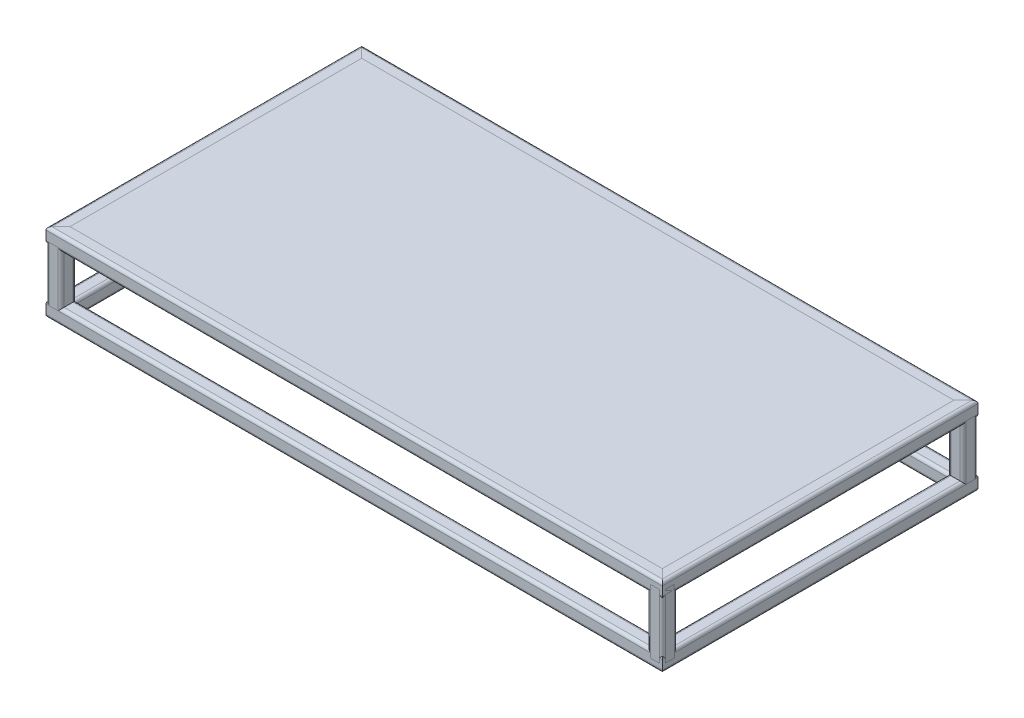
from build123d import *

# Parameters (mm, degrees)
SQUARE_TUBE_20_X_20_X_2_1_DEPTH      = 815.142135624
SQUARE_TUBE_20_X_20_X_2_1_DEPTH_BACK = 15.142135624
SQUARE_TUBE_20_X_20_X_2_1_2_DEPTH    = 430.284271247
SQUARE_TUBE_20_X_20_X_2_1_3_DEPTH    = 830.284271247
SQUARE_TUBE_20_X_20_X_2_1_4_DEPTH    = 430.284271247
SQUARE_TUBE_20_X_20_X_2_2_DEPTH      = 85
SQUARE_TUBE_20_X_20_X_2_2_2_DEPTH    = 85
SQUARE_TUBE_20_X_20_X_2_2_3_DEPTH    = 85
SQUARE_TUBE_20_X_20_X_2_2_4_DEPTH    = 85
SKETCH12_W                           = 788
SKETCH12_H                           = 388
BASE_FLANGE1_DEPTH                   = 2
SQUARE_TUBE_20_X_20_X_2_3_DEPTH      = 415.142135624
SQUARE_TUBE_20_X_20_X_2_3_DEPTH_BACK = 15.142135624
SQUARE_TUBE_20_X_20_X_2_3_2_DEPTH    = 830.284271247
SQUARE_TUBE_20_X_20_X_2_3_3_DEPTH    = 430.284271247
SQUARE_TUBE_20_X_20_X_2_3_4_DEPTH    = 830.284271247


# Sheet-metal steps are written as plain solids
with BuildPart() as part:
    # Sketch11 → Square tube 20 X 20 X 2(1) (new, two sides: drawn at the far end of the back side and taken through both)
    with BuildSketch(Plane(origin=(0, 85, 0), x_dir=(0, 0, -1), z_dir=(1, 0, 0)).offset(-SQUARE_TUBE_20_X_20_X_2_1_DEPTH_BACK)):
        with BuildLine():
            Line((-6, -10), (6, -10))
            ThreePointArc((6, -10), (8.828427125, -8.828427125), (10, -6))
            Line((10, -6), (10, 6))
            ThreePointArc((10, 6), (8.828427125, 8.828427125), (6, 10))
            Line((6, 10), (-6, 10))
            ThreePointArc((-6, 10), (-8.828427125, 8.828427125), (-10, 6))
            Line((-10, 6), (-10, -6))
            ThreePointArc((-10, -6), (-8.828427125, -8.828427125), (-6, -10))
        make_face()
        with BuildLine():
            Line((-6, -8), (6, -8))
            ThreePointArc((6, -8), (7.414213562, -7.414213562), (8, -6))
            Line((8, -6), (8, 6))
            ThreePointArc((8, 6), (7.414213562, 7.414213562), (6, 8))
            Line((6, 8), (-6, 8))
            ThreePointArc((-6, 8), (-7.414213562, 7.414213562), (-8, 6))
            Line((-8, 6), (-8, -6))
            ThreePointArc((-8, -6), (-7.414213562, -7.414213562), (-6, -8))
        make_face(mode=Mode.SUBTRACT)
    extrude(amount=SQUARE_TUBE_20_X_20_X_2_1_DEPTH + SQUARE_TUBE_20_X_20_X_2_1_DEPTH_BACK)

    # Square tube 20 X 20 X 2(1) mitre 1
    split(bisect_by=Plane(origin=(0, 85, 0), x_dir=(0, 1, 0), z_dir=(0.707106781, 0, 0.707106781)), keep=Keep.TOP)

    # Square tube 20 X 20 X 2(1) mitre 2
    split(bisect_by=Plane(origin=(800, 85, 0), x_dir=(0, -1, 0), z_dir=(-0.707106781, 0, 0.707106781)), keep=Keep.TOP)


with BuildPart() as body_2:
    # Sketch11 on segment 2 (carried to segment 2) → Square tube 20 X 20 X 2_1 2 (new body)
    with BuildSketch(Plane(origin=(800, 85, 15.142135624), x_dir=(-1, 0, 0), z_dir=(0, 0, -1))):
        with BuildLine():
            Line((-6, -10), (6, -10))
            ThreePointArc((6, -10), (8.828427125, -8.828427125), (10, -6))
            Line((10, -6), (10, 6))
            ThreePointArc((10, 6), (8.828427125, 8.828427125), (6, 10))
            Line((6, 10), (-6, 10))
            ThreePointArc((-6, 10), (-8.828427125, 8.828427125), (-10, 6))
            Line((-10, 6), (-10, -6))
            ThreePointArc((-10, -6), (-8.828427125, -8.828427125), (-6, -10))
        make_face()
        with BuildLine():
            Line((-6, -8), (6, -8))
            ThreePointArc((6, -8), (7.414213562, -7.414213562), (8, -6))
            Line((8, -6), (8, 6))
            ThreePointArc((8, 6), (7.414213562, 7.414213562), (6, 8))
            Line((6, 8), (-6, 8))
            ThreePointArc((-6, 8), (-7.414213562, 7.414213562), (-8, 6))
            Line((-8, 6), (-8, -6))
            ThreePointArc((-8, -6), (-7.414213562, -7.414213562), (-6, -8))
        make_face(mode=Mode.SUBTRACT)
    extrude(amount=SQUARE_TUBE_20_X_20_X_2_1_2_DEPTH)

    # Square tube 20 X 20 X 2_1 2 mitre 1
    split(bisect_by=Plane(origin=(800, 85, 0), x_dir=(0, 1, 0), z_dir=(0.707106781, 0, -0.707106781)), keep=Keep.TOP)

    # Square tube 20 X 20 X 2_1 2 mitre 2
    split(bisect_by=Plane(origin=(800, 85, -400), x_dir=(0, 1, 0), z_dir=(0.707106781, 0, 0.707106781)), keep=Keep.TOP)


with BuildPart() as body_3:
    # Sketch11 on segment 3 (carried to segment 3) → Square tube 20 X 20 X 2_1 3 (new body)
    with BuildSketch(Plane(origin=(815.142135624, 85, -400), x_dir=(0, 0, 1), z_dir=(-1, 0, 0))):
        with BuildLine():
            Line((-6, -10), (6, -10))
            ThreePointArc((6, -10), (8.828427125, -8.828427125), (10, -6))
            Line((10, -6), (10, 6))
            ThreePointArc((10, 6), (8.828427125, 8.828427125), (6, 10))
            Line((6, 10), (-6, 10))
            ThreePointArc((-6, 10), (-8.828427125, 8.828427125), (-10, 6))
            Line((-10, 6), (-10, -6))
            ThreePointArc((-10, -6), (-8.828427125, -8.828427125), (-6, -10))
        make_face()
        with BuildLine():
            Line((-6, -8), (6, -8))
            ThreePointArc((6, -8), (7.414213562, -7.414213562), (8, -6))
            Line((8, -6), (8, 6))
            ThreePointArc((8, 6), (7.414213562, 7.414213562), (6, 8))
            Line((6, 8), (-6, 8))
            ThreePointArc((-6, 8), (-7.414213562, 7.414213562), (-8, 6))
            Line((-8, 6), (-8, -6))
            ThreePointArc((-8, -6), (-7.414213562, -7.414213562), (-6, -8))
        make_face(mode=Mode.SUBTRACT)
    extrude(amount=SQUARE_TUBE_20_X_20_X_2_1_3_DEPTH)

    # Square tube 20 X 20 X 2_1 3 mitre 1
    split(bisect_by=Plane(origin=(0, 85, -400), x_dir=(0, 1, 0), z_dir=(0.707106781, 0, -0.707106781)), keep=Keep.TOP)

    # Square tube 20 X 20 X 2_1 3 mitre 2
    split(bisect_by=Plane(origin=(800, 85, -400), x_dir=(0, -1, 0), z_dir=(-0.707106781, 0, -0.707106781)), keep=Keep.TOP)


with BuildPart() as body_4:
    # Sketch11 on segment 4 (carried to segment 4) → Square tube 20 X 20 X 2_1 4 (new body)
    with BuildSketch(Plane(origin=(0, 85, -415.142135624), x_dir=(1, 0, 0), z_dir=(0, 0, 1))):
        with BuildLine():
            Line((-6, -10), (6, -10))
            ThreePointArc((6, -10), (8.828427125, -8.828427125), (10, -6))
            Line((10, -6), (10, 6))
            ThreePointArc((10, 6), (8.828427125, 8.828427125), (6, 10))
            Line((6, 10), (-6, 10))
            ThreePointArc((-6, 10), (-8.828427125, 8.828427125), (-10, 6))
            Line((-10, 6), (-10, -6))
            ThreePointArc((-10, -6), (-8.828427125, -8.828427125), (-6, -10))
        make_face()
        with BuildLine():
            Line((-6, -8), (6, -8))
            ThreePointArc((6, -8), (7.414213562, -7.414213562), (8, -6))
            Line((8, -6), (8, 6))
            ThreePointArc((8, 6), (7.414213562, 7.414213562), (6, 8))
            Line((6, 8), (-6, 8))
            ThreePointArc((-6, 8), (-7.414213562, 7.414213562), (-8, 6))
            Line((-8, 6), (-8, -6))
            ThreePointArc((-8, -6), (-7.414213562, -7.414213562), (-6, -8))
        make_face(mode=Mode.SUBTRACT)
    extrude(amount=SQUARE_TUBE_20_X_20_X_2_1_4_DEPTH)

    # Square tube 20 X 20 X 2_1 4 mitre 1
    split(bisect_by=Plane(origin=(0, 85, 0), x_dir=(0, -1, 0), z_dir=(-0.707106781, 0, -0.707106781)), keep=Keep.TOP)

    # Square tube 20 X 20 X 2_1 4 mitre 2
    split(bisect_by=Plane(origin=(0, 85, -400), x_dir=(0, -1, 0), z_dir=(-0.707106781, 0, 0.707106781)), keep=Keep.TOP)


with BuildPart() as body_5:
    # Sketch1 → Square tube 20 X 20 X 2(2) (new body)
    with BuildSketch(Plane(origin=(0, 0, 0), x_dir=(1, 0, 0), z_dir=(0, 1, 0))):
        with BuildLine():
            Line((-6, -10), (6, -10))
            ThreePointArc((6, -10), (8.828427125, -8.828427125), (10, -6))
            Line((10, -6), (10, 6))
            ThreePointArc((10, 6), (8.828427125, 8.828427125), (6, 10))
            Line((6, 10), (-6, 10))
            ThreePointArc((-6, 10), (-8.828427125, 8.828427125), (-10, 6))
            Line((-10, 6), (-10, -6))
            ThreePointArc((-10, -6), (-8.828427125, -8.828427125), (-6, -10))
        make_face()
        with BuildLine():
            Line((-6, -8), (6, -8))
            ThreePointArc((6, -8), (7.414213562, -7.414213562), (8, -6))
            Line((8, -6), (8, 6))
            ThreePointArc((8, 6), (7.414213562, 7.414213562), (6, 8))
            Line((6, 8), (-6, 8))
            ThreePointArc((-6, 8), (-7.414213562, 7.414213562), (-8, 6))
            Line((-8, 6), (-8, -6))
            ThreePointArc((-8, -6), (-7.414213562, -7.414213562), (-6, -8))
        make_face(mode=Mode.SUBTRACT)
    extrude(amount=SQUARE_TUBE_20_X_20_X_2_2_DEPTH)


with BuildPart() as body_6:
    # Sketch1 on segment 2 (carried to segment 2) → Square tube 20 X 20 X 2_2 2 (new body)
    with BuildSketch(Plane(origin=(0, 0, -400), x_dir=(1, 0, 0), z_dir=(0, 1, 0))):
        with BuildLine():
            Line((-6, -10), (6, -10))
            ThreePointArc((6, -10), (8.828427125, -8.828427125), (10, -6))
            Line((10, -6), (10, 6))
            ThreePointArc((10, 6), (8.828427125, 8.828427125), (6, 10))
            Line((6, 10), (-6, 10))
            ThreePointArc((-6, 10), (-8.828427125, 8.828427125), (-10, 6))
            Line((-10, 6), (-10, -6))
            ThreePointArc((-10, -6), (-8.828427125, -8.828427125), (-6, -10))
        make_face()
        with BuildLine():
            Line((-6, -8), (6, -8))
            ThreePointArc((6, -8), (7.414213562, -7.414213562), (8, -6))
            Line((8, -6), (8, 6))
            ThreePointArc((8, 6), (7.414213562, 7.414213562), (6, 8))
            Line((6, 8), (-6, 8))
            ThreePointArc((-6, 8), (-7.414213562, 7.414213562), (-8, 6))
            Line((-8, 6), (-8, -6))
            ThreePointArc((-8, -6), (-7.414213562, -7.414213562), (-6, -8))
        make_face(mode=Mode.SUBTRACT)
    extrude(amount=SQUARE_TUBE_20_X_20_X_2_2_2_DEPTH)


with BuildPart() as body_7:
    # Sketch1 on segment 3 (carried to segment 3) → Square tube 20 X 20 X 2_2 3 (new body)
    with BuildSketch(Plane(origin=(800, 0, 0), x_dir=(1, 0, 0), z_dir=(0, 1, 0))):
        with BuildLine():
            Line((-6, -10), (6, -10))
            ThreePointArc((6, -10), (8.828427125, -8.828427125), (10, -6))
            Line((10, -6), (10, 6))
            ThreePointArc((10, 6), (8.828427125, 8.828427125), (6, 10))
            Line((6, 10), (-6, 10))
            ThreePointArc((-6, 10), (-8.828427125, 8.828427125), (-10, 6))
            Line((-10, 6), (-10, -6))
            ThreePointArc((-10, -6), (-8.828427125, -8.828427125), (-6, -10))
        make_face()
        with BuildLine():
            Line((-6, -8), (6, -8))
            ThreePointArc((6, -8), (7.414213562, -7.414213562), (8, -6))
            Line((8, -6), (8, 6))
            ThreePointArc((8, 6), (7.414213562, 7.414213562), (6, 8))
            Line((6, 8), (-6, 8))
            ThreePointArc((-6, 8), (-7.414213562, 7.414213562), (-8, 6))
            Line((-8, 6), (-8, -6))
            ThreePointArc((-8, -6), (-7.414213562, -7.414213562), (-6, -8))
        make_face(mode=Mode.SUBTRACT)
    extrude(amount=SQUARE_TUBE_20_X_20_X_2_2_3_DEPTH)


with BuildPart() as body_8:
    # Sketch1 on segment 4 (carried to segment 4) → Square tube 20 X 20 X 2_2 4 (new body)
    with BuildSketch(Plane(origin=(800, 0, -400), x_dir=(1, 0, 0), z_dir=(0, 1, 0))):
        with BuildLine():
            Line((-6, -10), (6, -10))
            ThreePointArc((6, -10), (8.828427125, -8.828427125), (10, -6))
            Line((10, -6), (10, 6))
            ThreePointArc((10, 6), (8.828427125, 8.828427125), (6, 10))
            Line((6, 10), (-6, 10))
            ThreePointArc((-6, 10), (-8.828427125, 8.828427125), (-10, 6))
            Line((-10, 6), (-10, -6))
            ThreePointArc((-10, -6), (-8.828427125, -8.828427125), (-6, -10))
        make_face()
        with BuildLine():
            Line((-6, -8), (6, -8))
            ThreePointArc((6, -8), (7.414213562, -7.414213562), (8, -6))
            Line((8, -6), (8, 6))
            ThreePointArc((8, 6), (7.414213562, 7.414213562), (6, 8))
            Line((6, 8), (-6, 8))
            ThreePointArc((-6, 8), (-7.414213562, 7.414213562), (-8, 6))
            Line((-8, 6), (-8, -6))
            ThreePointArc((-8, -6), (-7.414213562, -7.414213562), (-6, -8))
        make_face(mode=Mode.SUBTRACT)
    extrude(amount=SQUARE_TUBE_20_X_20_X_2_2_4_DEPTH)


with BuildPart() as body_9:
    # Sketch12 → Base-Flange1 (new body)
    with BuildSketch(Plane(origin=(0, 95, 0), x_dir=(1, 0, 0), z_dir=(0, 1, 0))):
        with Locations((400, 200)):
            Rectangle(SKETCH12_W, SKETCH12_H)
    extrude(amount=-BASE_FLANGE1_DEPTH)


with BuildPart() as body_10:
    # Sketch13 → Square tube 20 X 20 X 2(3) (new, two sides: drawn at the far end of the back side and taken through both)
    with BuildSketch(Plane.XY.offset(-400).offset(-SQUARE_TUBE_20_X_20_X_2_3_DEPTH_BACK)):
        with BuildLine():
            Line((-6, -10), (6, -10))
            ThreePointArc((6, -10), (8.828427125, -8.828427125), (10, -6))
            Line((10, -6), (10, 6))
            ThreePointArc((10, 6), (8.828427125, 8.828427125), (6, 10))
            Line((6, 10), (-6, 10))
            ThreePointArc((-6, 10), (-8.828427125, 8.828427125), (-10, 6))
            Line((-10, 6), (-10, -6))
            ThreePointArc((-10, -6), (-8.828427125, -8.828427125), (-6, -10))
        make_face()
        with BuildLine():
            Line((-6, -8), (6, -8))
            ThreePointArc((6, -8), (7.414213562, -7.414213562), (8, -6))
            Line((8, -6), (8, 6))
            ThreePointArc((8, 6), (7.414213562, 7.414213562), (6, 8))
            Line((6, 8), (-6, 8))
            ThreePointArc((-6, 8), (-7.414213562, 7.414213562), (-8, 6))
            Line((-8, 6), (-8, -6))
            ThreePointArc((-8, -6), (-7.414213562, -7.414213562), (-6, -8))
        make_face(mode=Mode.SUBTRACT)
    extrude(amount=SQUARE_TUBE_20_X_20_X_2_3_DEPTH + SQUARE_TUBE_20_X_20_X_2_3_DEPTH_BACK)

    # Square tube 20 X 20 X 2(3) mitre 1
    split(bisect_by=Plane(origin=(0, 0, -400), x_dir=(0, -1, 0), z_dir=(-0.707106781, 0, 0.707106781)), keep=Keep.TOP)

    # Square tube 20 X 20 X 2(3) mitre 2
    split(bisect_by=Plane(origin=(0, 0, 0), x_dir=(0, -1, 0), z_dir=(-0.707106781, 0, -0.707106781)), keep=Keep.TOP)


with BuildPart() as body_11:
    # Sketch13 on segment 2 (carried to segment 2) → Square tube 20 X 20 X 2_3 2 (new body)
    with BuildSketch(Plane(origin=(-15.142135624, 0, 0), x_dir=(0, 0, -1), z_dir=(1, 0, 0))):
        with BuildLine():
            Line((-6, -10), (6, -10))
            ThreePointArc((6, -10), (8.828427125, -8.828427125), (10, -6))
            Line((10, -6), (10, 6))
            ThreePointArc((10, 6), (8.828427125, 8.828427125), (6, 10))
            Line((6, 10), (-6, 10))
            ThreePointArc((-6, 10), (-8.828427125, 8.828427125), (-10, 6))
            Line((-10, 6), (-10, -6))
            ThreePointArc((-10, -6), (-8.828427125, -8.828427125), (-6, -10))
        make_face()
        with BuildLine():
            Line((-6, -8), (6, -8))
            ThreePointArc((6, -8), (7.414213562, -7.414213562), (8, -6))
            Line((8, -6), (8, 6))
            ThreePointArc((8, 6), (7.414213562, 7.414213562), (6, 8))
            Line((6, 8), (-6, 8))
            ThreePointArc((-6, 8), (-7.414213562, 7.414213562), (-8, 6))
            Line((-8, 6), (-8, -6))
            ThreePointArc((-8, -6), (-7.414213562, -7.414213562), (-6, -8))
        make_face(mode=Mode.SUBTRACT)
    extrude(amount=SQUARE_TUBE_20_X_20_X_2_3_2_DEPTH)

    # Square tube 20 X 20 X 2_3 2 mitre 1
    split(bisect_by=Plane(origin=(0, 0, 0), x_dir=(0, 1, 0), z_dir=(0.707106781, 0, 0.707106781)), keep=Keep.TOP)

    # Square tube 20 X 20 X 2_3 2 mitre 2
    split(bisect_by=Plane(origin=(800, 0, 0), x_dir=(0, -1, 0), z_dir=(-0.707106781, 0, 0.707106781)), keep=Keep.TOP)


with BuildPart() as body_12:
    # Sketch13 on segment 3 (carried to segment 3) → Square tube 20 X 20 X 2_3 3 (new body)
    with BuildSketch(Plane(origin=(800, 0, 15.142135624), x_dir=(-1, 0, 0), z_dir=(0, 0, -1))):
        with BuildLine():
            Line((-6, -10), (6, -10))
            ThreePointArc((6, -10), (8.828427125, -8.828427125), (10, -6))
            Line((10, -6), (10, 6))
            ThreePointArc((10, 6), (8.828427125, 8.828427125), (6, 10))
            Line((6, 10), (-6, 10))
            ThreePointArc((-6, 10), (-8.828427125, 8.828427125), (-10, 6))
            Line((-10, 6), (-10, -6))
            ThreePointArc((-10, -6), (-8.828427125, -8.828427125), (-6, -10))
        make_face()
        with BuildLine():
            Line((-6, -8), (6, -8))
            ThreePointArc((6, -8), (7.414213562, -7.414213562), (8, -6))
            Line((8, -6), (8, 6))
            ThreePointArc((8, 6), (7.414213562, 7.414213562), (6, 8))
            Line((6, 8), (-6, 8))
            ThreePointArc((-6, 8), (-7.414213562, 7.414213562), (-8, 6))
            Line((-8, 6), (-8, -6))
            ThreePointArc((-8, -6), (-7.414213562, -7.414213562), (-6, -8))
        make_face(mode=Mode.SUBTRACT)
    extrude(amount=SQUARE_TUBE_20_X_20_X_2_3_3_DEPTH)

    # Square tube 20 X 20 X 2_3 3 mitre 1
    split(bisect_by=Plane(origin=(800, 0, 0), x_dir=(0, 1, 0), z_dir=(0.707106781, 0, -0.707106781)), keep=Keep.TOP)

    # Square tube 20 X 20 X 2_3 3 mitre 2
    split(bisect_by=Plane(origin=(800, 0, -400), x_dir=(0, 1, 0), z_dir=(0.707106781, 0, 0.707106781)), keep=Keep.TOP)


with BuildPart() as body_13:
    # Sketch13 on segment 4 (carried to segment 4) → Square tube 20 X 20 X 2_3 4 (new body)
    with BuildSketch(Plane(origin=(815.142135624, 0, -400), x_dir=(0, 0, 1), z_dir=(-1, 0, 0))):
        with BuildLine():
            Line((-6, -10), (6, -10))
            ThreePointArc((6, -10), (8.828427125, -8.828427125), (10, -6))
            Line((10, -6), (10, 6))
            ThreePointArc((10, 6), (8.828427125, 8.828427125), (6, 10))
            Line((6, 10), (-6, 10))
            ThreePointArc((-6, 10), (-8.828427125, 8.828427125), (-10, 6))
            Line((-10, 6), (-10, -6))
            ThreePointArc((-10, -6), (-8.828427125, -8.828427125), (-6, -10))
        make_face()
        with BuildLine():
            Line((-6, -8), (6, -8))
            ThreePointArc((6, -8), (7.414213562, -7.414213562), (8, -6))
            Line((8, -6), (8, 6))
            ThreePointArc((8, 6), (7.414213562, 7.414213562), (6, 8))
            Line((6, 8), (-6, 8))
            ThreePointArc((-6, 8), (-7.414213562, 7.414213562), (-8, 6))
            Line((-8, 6), (-8, -6))
            ThreePointArc((-8, -6), (-7.414213562, -7.414213562), (-6, -8))
        make_face(mode=Mode.SUBTRACT)
    extrude(amount=SQUARE_TUBE_20_X_20_X_2_3_4_DEPTH)

    # Square tube 20 X 20 X 2_3 4 mitre 1
    split(bisect_by=Plane(origin=(0, 0, -400), x_dir=(0, 1, 0), z_dir=(0.707106781, 0, -0.707106781)), keep=Keep.TOP)

    # Square tube 20 X 20 X 2_3 4 mitre 2
    split(bisect_by=Plane(origin=(800, 0, -400), x_dir=(0, -1, 0), z_dir=(-0.707106781, 0, -0.707106781)), keep=Keep.TOP)


solid = Compound([part.part, body_2.part, body_3.part, body_4.part, body_5.part, body_6.part, body_7.part, body_8.part, body_9.part, body_10.part, body_11.part, body_12.part, body_13.part])
